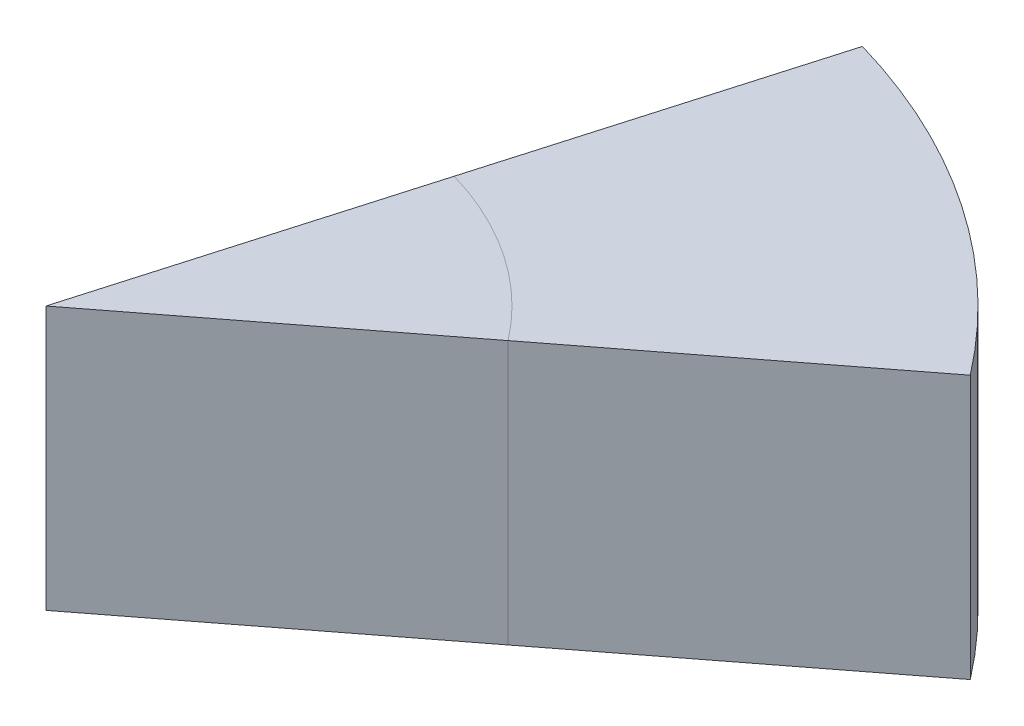
from build123d import *

# Parameters (mm, degrees)
BASE_FLANGE1_DEPTH = 10


# Sheet-metal steps are written as plain solids
with BuildPart() as part:
    # Sketch2 → Base-Flange1 (new body)
    with BuildSketch(Plane(origin=(0, 0, 0), x_dir=(1, 0, 0), z_dir=(0, 1, 0))):
        with BuildLine():
            Line((0, 0), (6.957549204, 24.012340766))
            ThreePointArc((6.957549204, 24.012340766), (14.078605139, 20.658966028), (19.80408702, 15.257723857))
            Line((19.80408702, 15.257723857), (0, 0))
        make_face()
    extrude(amount=BASE_FLANGE1_DEPTH)


solid = part.part
